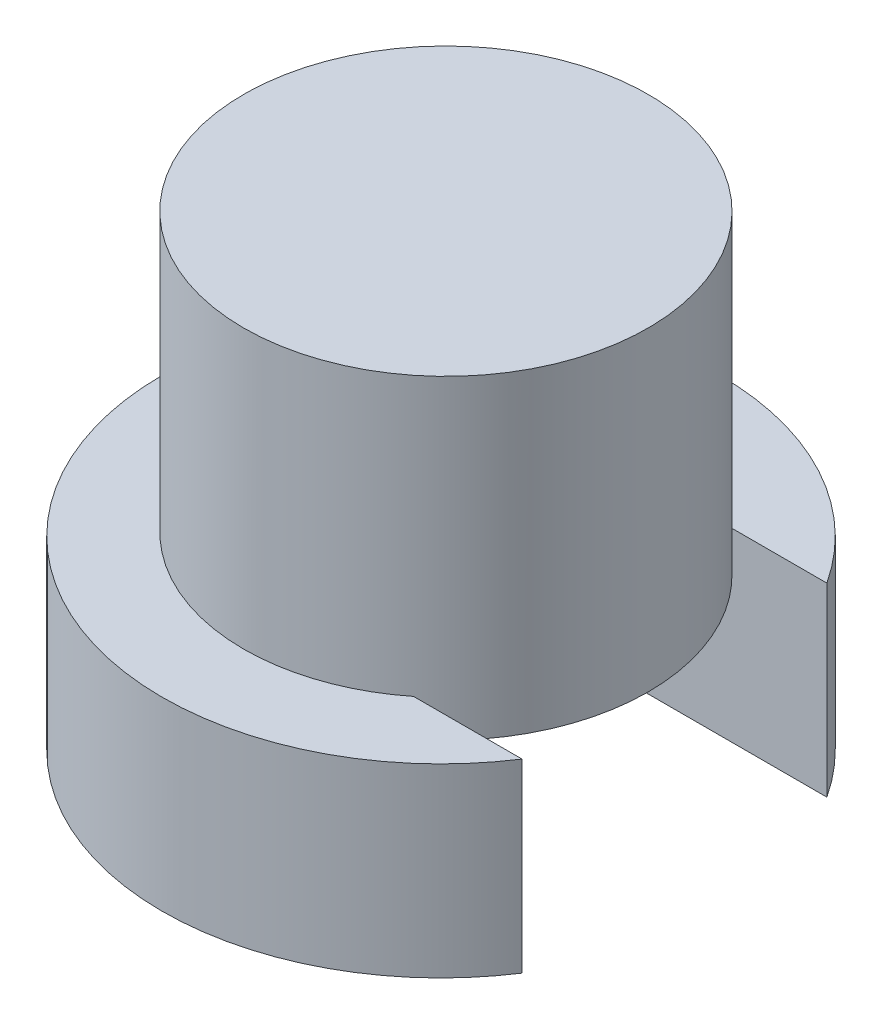
from build123d import *

# Parameters (mm, degrees)
BOSS_EXTRUDE1_DEPTH = 20
SKETCH3_R           = 21.825376461
BOSS_EXTRUDE2_DEPTH = 34


with BuildPart() as part:
    # Sketch1 → Boss-Extrude1 (new body)
    with BuildSketch(Plane(origin=(0, 0, 0), x_dir=(1, 0, 0), z_dir=(0, 1, 0))):
        with BuildLine():
            Line((3.829354512, 0), (-21.353730716, 0))
            Line((-21.353730716, 0), (-21.353730716, 32.88170544))
            Line((-21.353730716, 32.88170544), (3.829354512, 32.88170544))
            ThreePointArc((3.829354512, 32.88170544), (-51.428461302, 16.44085272), (3.829354512, 0))
        make_face()
    extrude(amount=BOSS_EXTRUDE1_DEPTH)

    # Sketch3 → Boss-Extrude2 (add)
    with BuildSketch(Plane(origin=(0, 50, 0), x_dir=(1, 0, 0), z_dir=(0, 1, 0))):
        with Locations((-21.461752658, 17.080335359)):
            Circle(SKETCH3_R)
    extrude(amount=-BOSS_EXTRUDE2_DEPTH)


solid = part.part
